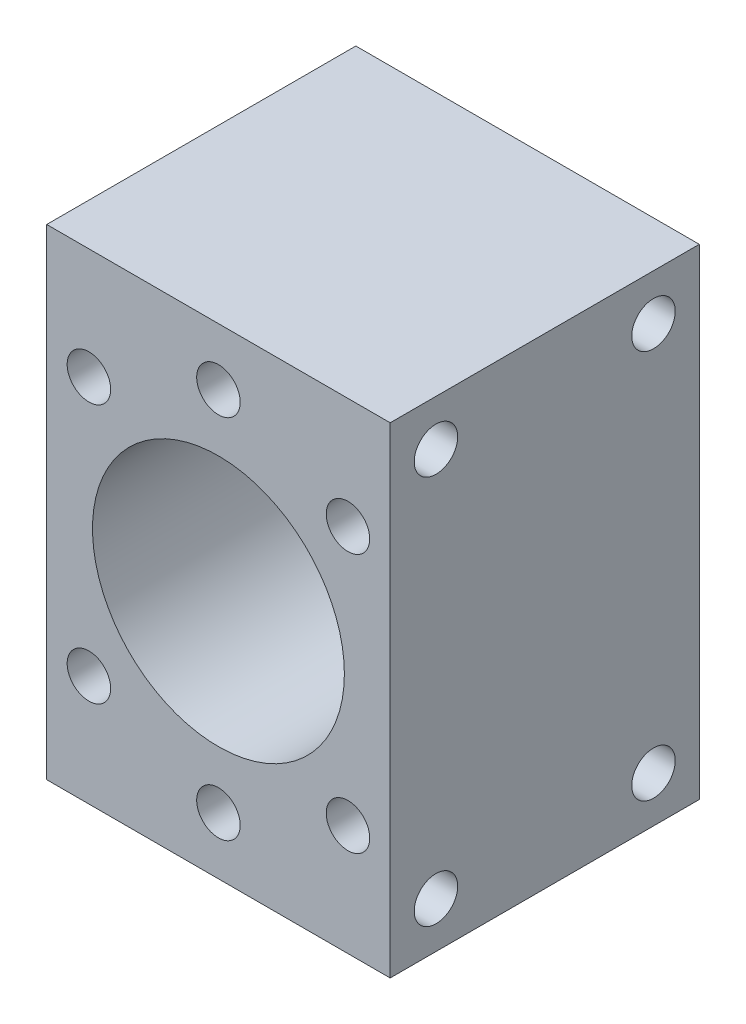
from build123d import *

# Parameters (mm, degrees)
SKETCH1_W           = 30
SKETCH1_H           = 42
BOSS_EXTRUDE1_DEPTH = 13.5
SKETCH2_R           = 11
CUT_EXTRUDE1_DEPTH  = 38.349698794
SKETCH3_R           = 1.9
CUT_EXTRUDE2_DEPTH  = 10
SKETCH6_R           = 1.9
CUT_EXTRUDE3_DEPTH  = 10


with BuildPart() as part:
    # Sketch1 → Boss-Extrude1 (new, symmetric)
    with BuildSketch(Plane.XY):
        Rectangle(SKETCH1_W, SKETCH1_H)
    extrude(amount=BOSS_EXTRUDE1_DEPTH, both=True)

    # Sketch2 → Cut-Extrude1 (cut, through all)
    with BuildSketch(Plane.XY.offset(13.5)):
        Circle(SKETCH2_R)
    extrude(amount=-CUT_EXTRUDE1_DEPTH, mode=Mode.SUBTRACT)

    # Sketch3 → Cut-Extrude2 (cut)
    with BuildSketch(Plane.XY.offset(13.5)):
        with Locations((-11.313708499, 11.313708499)):
            Circle(SKETCH3_R)
        with Locations((0, 16)):
            Circle(SKETCH3_R)
        with Locations((11.313708499, 11.313708499)):
            Circle(SKETCH3_R)
        with Locations((11.313708499, -11.313708499)):
            Circle(SKETCH3_R)
        with Locations((0, -16)):
            Circle(SKETCH3_R)
        with Locations((-11.313708499, -11.313708499)):
            Circle(SKETCH3_R)
    extrude(amount=-CUT_EXTRUDE2_DEPTH, mode=Mode.SUBTRACT)

    # Sketch6 → Cut-Extrude3 (cut)
    with BuildSketch(Plane(origin=(15, 0, 0), x_dir=(0, 0, -1), z_dir=(1, 0, 0))):
        with Locations((9.5, 17)):
            Circle(SKETCH6_R)
        with Locations((-9.5, 17)):
            Circle(SKETCH6_R)
        with Locations((9.5, -17)):
            Circle(SKETCH6_R)
        with Locations((-9.5, -17)):
            Circle(SKETCH6_R)
    extrude(amount=-CUT_EXTRUDE3_DEPTH, mode=Mode.SUBTRACT)


solid = part.part
